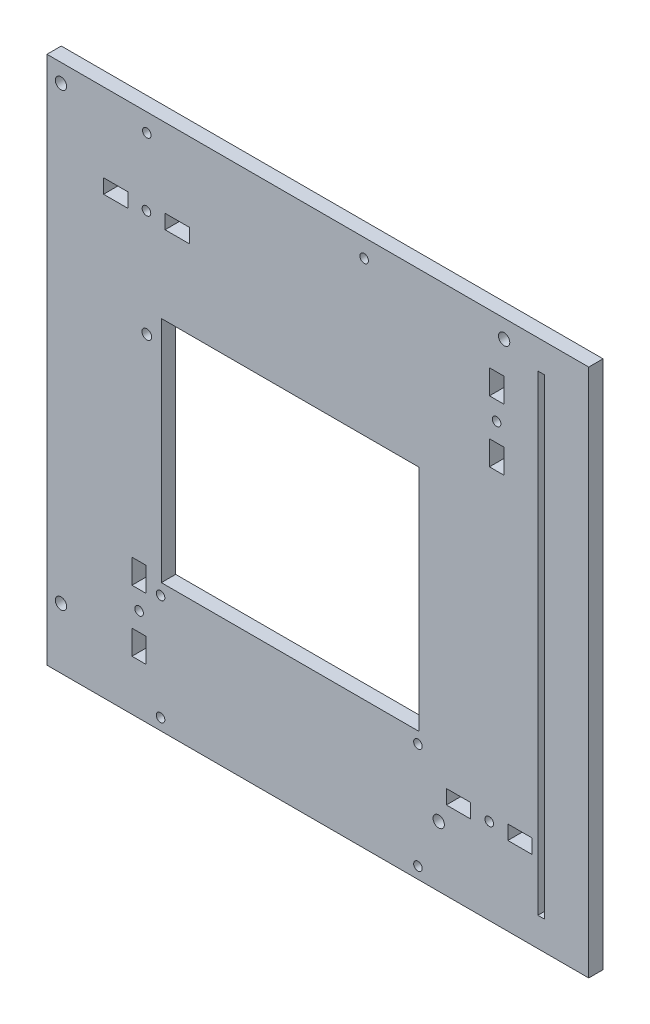
from build123d import *

# Parameters (mm, degrees)
SKETCH2_W           = 189.43
SKETCH2_H           = 185
SKETCH2_R           = 1.98
SKETCH2_R_2         = 1.5
SKETCH2_R_3         = 1.694817964
SKETCH2_W_2         = 2.32
SKETCH2_H_2         = 164.83
SKETCH2_W_3         = 8.5
SKETCH2_H_3         = 5
SKETCH2_W_4         = 90
SKETCH2_H_4         = 80
SKETCH2_W_5         = 5
SKETCH2_H_5         = 8.5
BOSS_EXTRUDE1_DEPTH = 5
SKETCH3_R           = 1.5
CUT_EXTRUDE1_DEPTH  = 10


with BuildPart() as part:
    # Sketch2 → Boss-Extrude1 (new body)
    with BuildSketch(Plane.XY):
        with Locations((9.715, -7.5)):
            Rectangle(SKETCH2_W, SKETCH2_H)
        with Locations((-80.1, 78.65)):
            Circle(SKETCH2_R, mode=Mode.SUBTRACT)
        with Locations((74.84, 78.65)):
            Circle(SKETCH2_R, mode=Mode.SUBTRACT)
        with Locations((51.98, -78.83)):
            Circle(SKETCH2_R, mode=Mode.SUBTRACT)
        with Locations((-80.1, -78.83)):
            Circle(SKETCH2_R, mode=Mode.SUBTRACT)
        with Locations((25.9, 78.65)):
            Circle(SKETCH2_R_2, mode=Mode.SUBTRACT)
        with Locations((-50.1, 78.65)):
            Circle(SKETCH2_R_2, mode=Mode.SUBTRACT)
        with Locations((-50.1, 17.65)):
            Circle(SKETCH2_R_3, mode=Mode.SUBTRACT)
        with Locations((-50.210927607, 55)):
            Circle(SKETCH2_R_2, mode=Mode.SUBTRACT)
        with Locations((72.215, 52.425927607)):
            Circle(SKETCH2_R_2, mode=Mode.SUBTRACT)
        with Locations((69.640927607, -70)):
            Circle(SKETCH2_R_2, mode=Mode.SUBTRACT)
        with Locations((-52.785, -67.425927607)):
            Circle(SKETCH2_R_2, mode=Mode.SUBTRACT)
        with Locations((87.77, -7.5)):
            Rectangle(SKETCH2_W_2, SKETCH2_H_2, mode=Mode.SUBTRACT)
        with Locations((-60.960927607, 55)):
            Rectangle(SKETCH2_W_3, SKETCH2_H_3, mode=Mode.SUBTRACT)
        with Locations((0, -15)):
            Rectangle(SKETCH2_W_4, SKETCH2_H_4, mode=Mode.SUBTRACT)
        with Locations((-39.460927607, 55)):
            Rectangle(SKETCH2_W_3, SKETCH2_H_3, mode=Mode.SUBTRACT)
        with Locations((72.215, 63.175927607)):
            Rectangle(SKETCH2_W_5, SKETCH2_H_5, mode=Mode.SUBTRACT)
        with Locations((72.215, 41.675927607)):
            Rectangle(SKETCH2_W_5, SKETCH2_H_5, mode=Mode.SUBTRACT)
        with Locations((80.390927607, -70)):
            Rectangle(SKETCH2_W_3, SKETCH2_H_3, mode=Mode.SUBTRACT)
        with Locations((58.890927607, -70)):
            Rectangle(SKETCH2_W_3, SKETCH2_H_3, mode=Mode.SUBTRACT)
        with Locations((-52.785, -78.175927607)):
            Rectangle(SKETCH2_W_5, SKETCH2_H_5, mode=Mode.SUBTRACT)
        with Locations((-52.785, -56.675927607)):
            Rectangle(SKETCH2_W_5, SKETCH2_H_5, mode=Mode.SUBTRACT)
    extrude(amount=BOSS_EXTRUDE1_DEPTH)

    # Sketch3 → Cut-Extrude1 (cut)
    with BuildSketch(Plane(origin=(0, 0, 5), x_dir=(-1, 0, 0), z_dir=(0, 0, 1))):
        with Locations((45.285, 59)):
            Circle(SKETCH3_R)
        with Locations((-44.715, 59)):
            Circle(SKETCH3_R)
        with Locations((-44.715, 96)):
            Circle(SKETCH3_R)
        with Locations((45.285, 96)):
            Circle(SKETCH3_R)
    extrude(amount=-CUT_EXTRUDE1_DEPTH, mode=Mode.SUBTRACT)


solid = part.part
